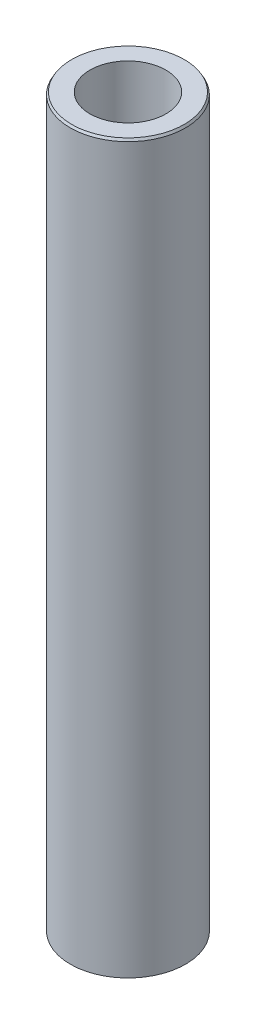
from build123d import *
from OCP.BRepFilletAPI import BRepFilletAPI_MakeChamfer

# Parameters (mm, degrees)
SKETCH1_R           = 47.5
BOSS_EXTRUDE1_DEPTH = 600
SKETCH2_R           = 31.322439878
CUT_EXTRUDE1_DEPTH  = 604.748706003
CHAMFER1_SIZE       = 1.931160372
CHAMFER1_SIZE2      = 1.114955961


with BuildPart() as part:
    # Sketch1 → Boss-Extrude1 (new body)
    with BuildSketch(Plane(origin=(0, 0, 0), x_dir=(1, 0, 0), z_dir=(0, 1, 0))):
        Circle(SKETCH1_R)
    extrude(amount=BOSS_EXTRUDE1_DEPTH)

    # Sketch2 → Cut-Extrude1 (cut, through all)
    with BuildSketch(Plane(origin=(0, 0, 0), x_dir=(1, 0, 0), z_dir=(0, 1, 0))):
        Circle(SKETCH2_R)
    extrude(amount=CUT_EXTRUDE1_DEPTH, mode=Mode.SUBTRACT)

    # Chamfer1: one chamfer whose edges measure the first distance from different faces: ONE call of the kernel's chamfer builder (chamfer() names one face for all edges)
    chamfer1_edges_1 = [part.edges().sort_by_distance(p)[0] for p in [
        (-47.5, 600, 0),
    ]]
    chamfer1_side_1 = [part.faces().sort_by_distance(p)[0] for p in [
        (-47.5, 300, 0),
    ]]
    chamfer1_edges_2 = [part.edges().sort_by_distance(p)[0] for p in [
        (-47.5, 0, 0),
    ]]
    chamfer1_side_2 = [part.faces().sort_by_distance(p)[0] for p in [
        (-46.156497116, 0, 0),
    ]]
    chamfer1 = BRepFilletAPI_MakeChamfer(part.part.solid().wrapped)
    for e in chamfer1_edges_1:
        chamfer1.Add(CHAMFER1_SIZE, CHAMFER1_SIZE2, e.wrapped, chamfer1_side_1[0].wrapped)  # the first distance lies on this face
    for e in chamfer1_edges_2:
        chamfer1.Add(CHAMFER1_SIZE, CHAMFER1_SIZE2, e.wrapped, chamfer1_side_2[0].wrapped)  # the first distance lies on this face
    add(Compound.cast(chamfer1.Shape()), mode=Mode.REPLACE)


solid = part.part
